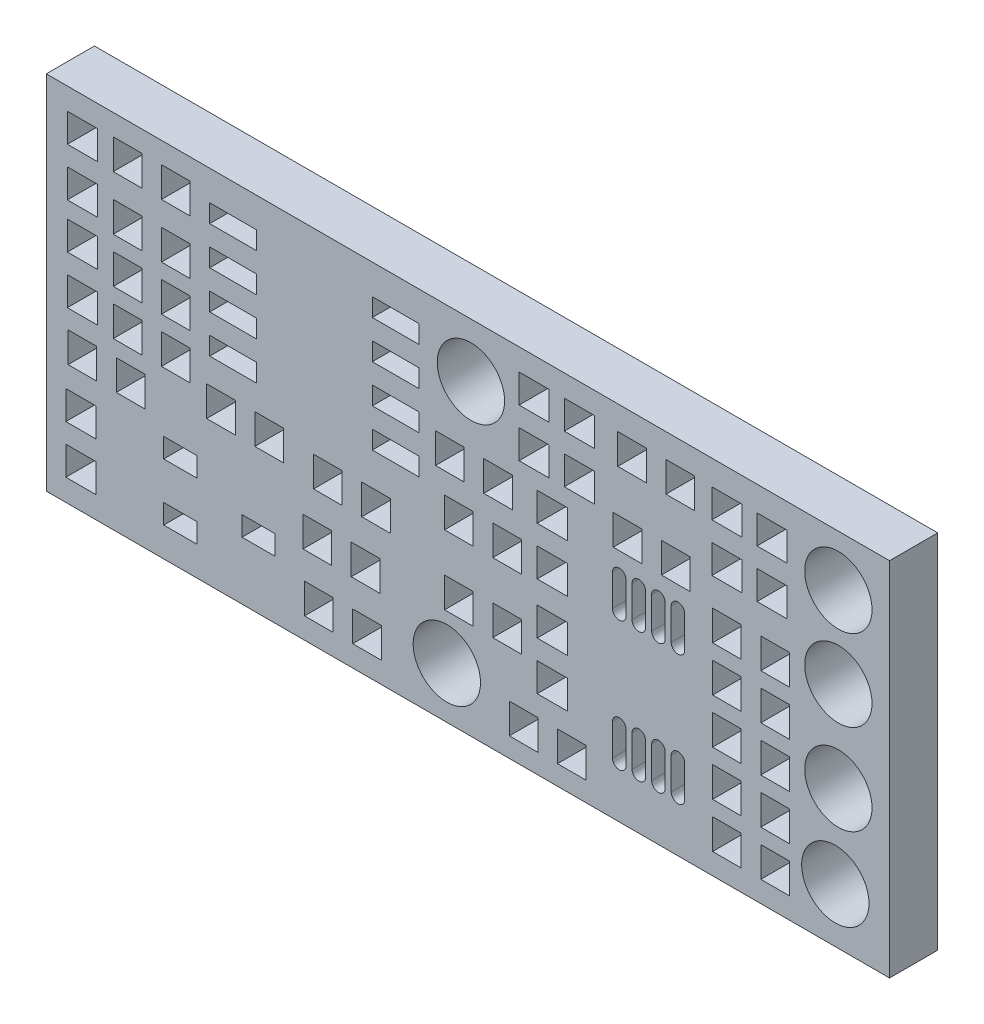
from build123d import *

# Parameters (mm, degrees)
MODEL_W            = 28
MODEL_H            = 12
MODEL_W_2          = 1
MODEL_H_2          = 0.95
MODEL_W_3          = 1.1
MODEL_H_3          = 0.65
MODEL_W_4          = 0.95
MODEL_H_4          = 1
MODEL_R            = 1.1176
MODEL_W_5          = 1.55
MODEL_H_5          = 0.6
BOSS_EXTRU_1_DEPTH = 1.6


with BuildPart() as part:
    # Model → Boss.-Extru.1 (new body)
    with BuildSketch(Plane.XY):
        with Locations((14, 6)):
            Rectangle(MODEL_W, MODEL_H)
        with Locations((1.15, 1.2)):
            Rectangle(MODEL_W_2, MODEL_H_2, mode=Mode.SUBTRACT)
        with Locations((4.45, 1.3)):
            Rectangle(MODEL_W_3, MODEL_H_3, mode=Mode.SUBTRACT)
        with Locations((1.15, 2.8)):
            Rectangle(MODEL_W_2, MODEL_H_2, mode=Mode.SUBTRACT)
        with Locations((9.05, 1.2)):
            Rectangle(MODEL_W_4, MODEL_H_4, mode=Mode.SUBTRACT)
        with Locations((10.65, 1.2)):
            Rectangle(MODEL_W_4, MODEL_H_4, mode=Mode.SUBTRACT)
        with Locations((7.05, 2.25)):
            Rectangle(MODEL_W_3, MODEL_H_3, mode=Mode.SUBTRACT)
        with Locations((13.3, 1.7)):
            Circle(MODEL_R, mode=Mode.SUBTRACT)
        with Locations((4.45, 3.2)):
            Rectangle(MODEL_W_3, MODEL_H_3, mode=Mode.SUBTRACT)
        with Locations((1.2, 4.5)):
            Rectangle(MODEL_W_4, MODEL_H_4, mode=Mode.SUBTRACT)
        with Locations((2.8, 4.5)):
            Rectangle(MODEL_W_4, MODEL_H_4, mode=Mode.SUBTRACT)
        with Locations((5.8, 5.25)):
            Rectangle(MODEL_W_4, MODEL_H_4, mode=Mode.SUBTRACT)
        with Locations((9, 3.1)):
            Rectangle(MODEL_W_4, MODEL_H_4, mode=Mode.SUBTRACT)
        with Locations((10.6, 3.1)):
            Rectangle(MODEL_W_4, MODEL_H_4, mode=Mode.SUBTRACT)
        with Locations((13.7, 3.7)):
            Rectangle(MODEL_W_4, MODEL_H_4, mode=Mode.SUBTRACT)
        with Locations((9.35, 5)):
            Rectangle(MODEL_W_4, MODEL_H_4, mode=Mode.SUBTRACT)
        with Locations((7.4, 5.25)):
            Rectangle(MODEL_W_4, MODEL_H_4, mode=Mode.SUBTRACT)
        with Locations((10.95, 5)):
            Rectangle(MODEL_W_4, MODEL_H_4, mode=Mode.SUBTRACT)
        with Locations((15.85, 1.15)):
            Rectangle(MODEL_W_4, MODEL_H_4, mode=Mode.SUBTRACT)
        with Locations((17.45, 1.15)):
            Rectangle(MODEL_W_4, MODEL_H_4, mode=Mode.SUBTRACT)
        with Locations((16.8, 2.8)):
            Rectangle(MODEL_W_2, MODEL_H_2, mode=Mode.SUBTRACT)
        with BuildLine():
            ThreePointArc((20.75, 2.775), (20.975, 3), (21.2, 2.775))
            Line((21.2, 2.775), (21.2, 1.725))
            ThreePointArc((21.2, 1.725), (20.975, 1.5), (20.75, 1.725))
            Line((20.75, 1.725), (20.75, 2.775))
        make_face(mode=Mode.SUBTRACT)
        with BuildLine():
            ThreePointArc((18.8, 2.775), (19.025, 3), (19.25, 2.775))
            Line((19.25, 2.775), (19.25, 1.725))
            ThreePointArc((19.25, 1.725), (19.025, 1.5), (18.8, 1.725))
            Line((18.8, 1.725), (18.8, 2.775))
        make_face(mode=Mode.SUBTRACT)
        with BuildLine():
            ThreePointArc((19.45, 2.775), (19.675, 3), (19.9, 2.775))
            Line((19.9, 2.775), (19.9, 1.725))
            ThreePointArc((19.9, 1.725), (19.675, 1.5), (19.45, 1.725))
            Line((19.45, 1.725), (19.45, 2.775))
        make_face(mode=Mode.SUBTRACT)
        with BuildLine():
            ThreePointArc((20.1, 2.775), (20.325, 3), (20.55, 2.775))
            Line((20.55, 2.775), (20.55, 1.725))
            ThreePointArc((20.55, 1.725), (20.325, 1.5), (20.1, 1.725))
            Line((20.1, 1.725), (20.1, 2.775))
        make_face(mode=Mode.SUBTRACT)
        with Locations((22.6, 1.2)):
            Rectangle(MODEL_W_4, MODEL_H_4, mode=Mode.SUBTRACT)
        with Locations((24.2, 1.2)):
            Rectangle(MODEL_W_4, MODEL_H_4, mode=Mode.SUBTRACT)
        with Locations((22.6, 2.7)):
            Rectangle(MODEL_W_4, MODEL_H_4, mode=Mode.SUBTRACT)
        with Locations((24.2, 2.7)):
            Rectangle(MODEL_W_4, MODEL_H_4, mode=Mode.SUBTRACT)
        with Locations((26.2, 1.8)):
            Circle(MODEL_R, mode=Mode.SUBTRACT)
        with Locations((15.3, 3.7)):
            Rectangle(MODEL_W_4, MODEL_H_4, mode=Mode.SUBTRACT)
        with Locations((16.8, 4.4)):
            Rectangle(MODEL_W_2, MODEL_H_2, mode=Mode.SUBTRACT)
        with Locations((22.6, 4.2)):
            Rectangle(MODEL_W_4, MODEL_H_4, mode=Mode.SUBTRACT)
        with Locations((24.2, 4.2)):
            Rectangle(MODEL_W_4, MODEL_H_4, mode=Mode.SUBTRACT)
        with Locations((22.6, 5.7)):
            Rectangle(MODEL_W_4, MODEL_H_4, mode=Mode.SUBTRACT)
        with Locations((24.2, 5.7)):
            Rectangle(MODEL_W_4, MODEL_H_4, mode=Mode.SUBTRACT)
        with Locations((26.3, 4.6)):
            Circle(MODEL_R, mode=Mode.SUBTRACT)
        with Locations((1.2, 6.1)):
            Rectangle(MODEL_W_2, MODEL_H_2, mode=Mode.SUBTRACT)
        with Locations((2.7, 6)):
            Rectangle(MODEL_W_4, MODEL_H_4, mode=Mode.SUBTRACT)
        with Locations((4.3, 6)):
            Rectangle(MODEL_W_4, MODEL_H_4, mode=Mode.SUBTRACT)
        with Locations((6.2, 6.895)):
            Rectangle(MODEL_W_5, MODEL_H_5, mode=Mode.SUBTRACT)
        with Locations((1.2, 7.7)):
            Rectangle(MODEL_W_2, MODEL_H_2, mode=Mode.SUBTRACT)
        with Locations((2.7, 7.5)):
            Rectangle(MODEL_W_4, MODEL_H_4, mode=Mode.SUBTRACT)
        with Locations((4.3, 7.5)):
            Rectangle(MODEL_W_4, MODEL_H_4, mode=Mode.SUBTRACT)
        with Locations((6.2, 8.165)):
            Rectangle(MODEL_W_5, MODEL_H_5, mode=Mode.SUBTRACT)
        with Locations((13.7, 6)):
            Rectangle(MODEL_W_4, MODEL_H_4, mode=Mode.SUBTRACT)
        with Locations((11.6, 6.895)):
            Rectangle(MODEL_W_5, MODEL_H_5, mode=Mode.SUBTRACT)
        with Locations((11.6, 8.165)):
            Rectangle(MODEL_W_5, MODEL_H_5, mode=Mode.SUBTRACT)
        with Locations((13.4, 7.7)):
            Rectangle(MODEL_W_4, MODEL_H_4, mode=Mode.SUBTRACT)
        with Locations((1.2, 9.2)):
            Rectangle(MODEL_W_2, MODEL_H_2, mode=Mode.SUBTRACT)
        with Locations((2.7, 9)):
            Rectangle(MODEL_W_4, MODEL_H_4, mode=Mode.SUBTRACT)
        with Locations((4.3, 9)):
            Rectangle(MODEL_W_4, MODEL_H_4, mode=Mode.SUBTRACT)
        with Locations((6.2, 9.435)):
            Rectangle(MODEL_W_5, MODEL_H_5, mode=Mode.SUBTRACT)
        with Locations((1.2, 10.8)):
            Rectangle(MODEL_W_2, MODEL_H_2, mode=Mode.SUBTRACT)
        with Locations((2.7, 10.8)):
            Rectangle(MODEL_W_4, MODEL_H_4, mode=Mode.SUBTRACT)
        with Locations((4.3, 10.8)):
            Rectangle(MODEL_W_4, MODEL_H_4, mode=Mode.SUBTRACT)
        with Locations((6.2, 10.705)):
            Rectangle(MODEL_W_5, MODEL_H_5, mode=Mode.SUBTRACT)
        with Locations((11.6, 9.435)):
            Rectangle(MODEL_W_5, MODEL_H_5, mode=Mode.SUBTRACT)
        with Locations((11.6, 10.705)):
            Rectangle(MODEL_W_5, MODEL_H_5, mode=Mode.SUBTRACT)
        with Locations((15.3, 6)):
            Rectangle(MODEL_W_4, MODEL_H_4, mode=Mode.SUBTRACT)
        with Locations((16.8, 6.1)):
            Rectangle(MODEL_W_2, MODEL_H_2, mode=Mode.SUBTRACT)
        with BuildLine():
            ThreePointArc((18.8, 7.075), (19.025, 7.3), (19.25, 7.075))
            Line((19.25, 7.075), (19.25, 6.025))
            ThreePointArc((19.25, 6.025), (19.025, 5.8), (18.8, 6.025))
            Line((18.8, 6.025), (18.8, 7.075))
        make_face(mode=Mode.SUBTRACT)
        with BuildLine():
            ThreePointArc((19.45, 7.075), (19.675, 7.3), (19.9, 7.075))
            Line((19.9, 7.075), (19.9, 6.025))
            ThreePointArc((19.9, 6.025), (19.675, 5.8), (19.45, 6.025))
            Line((19.45, 6.025), (19.45, 7.075))
        make_face(mode=Mode.SUBTRACT)
        with BuildLine():
            ThreePointArc((20.1, 7.075), (20.325, 7.3), (20.55, 7.075))
            Line((20.55, 7.075), (20.55, 6.025))
            ThreePointArc((20.55, 6.025), (20.325, 5.8), (20.1, 6.025))
            Line((20.1, 6.025), (20.1, 7.075))
        make_face(mode=Mode.SUBTRACT)
        with BuildLine():
            ThreePointArc((20.75, 7.075), (20.975, 7.3), (21.2, 7.075))
            Line((21.2, 7.075), (21.2, 6.025))
            ThreePointArc((21.2, 6.025), (20.975, 5.8), (20.75, 6.025))
            Line((20.75, 6.025), (20.75, 7.075))
        make_face(mode=Mode.SUBTRACT)
        with Locations((15, 7.7)):
            Rectangle(MODEL_W_4, MODEL_H_4, mode=Mode.SUBTRACT)
        with Locations((16.8, 7.7)):
            Rectangle(MODEL_W_2, MODEL_H_2, mode=Mode.SUBTRACT)
        with Locations((19.3, 8.3)):
            Rectangle(MODEL_W_4, MODEL_H_4, mode=Mode.SUBTRACT)
        with Locations((20.9, 8.3)):
            Rectangle(MODEL_W_4, MODEL_H_4, mode=Mode.SUBTRACT)
        with Locations((22.6, 7.2)):
            Rectangle(MODEL_W_4, MODEL_H_4, mode=Mode.SUBTRACT)
        with Locations((24.2, 7.2)):
            Rectangle(MODEL_W_4, MODEL_H_4, mode=Mode.SUBTRACT)
        with Locations((26.3, 7.6)):
            Circle(MODEL_R, mode=Mode.SUBTRACT)
        with Locations((16.2, 9.2)):
            Rectangle(MODEL_W_2, MODEL_H_2, mode=Mode.SUBTRACT)
        with Locations((14.1, 10.2)):
            Circle(MODEL_R, mode=Mode.SUBTRACT)
        with Locations((17.7, 9.2)):
            Rectangle(MODEL_W_2, MODEL_H_2, mode=Mode.SUBTRACT)
        with Locations((16.2, 10.8)):
            Rectangle(MODEL_W_2, MODEL_H_2, mode=Mode.SUBTRACT)
        with Locations((17.7, 10.8)):
            Rectangle(MODEL_W_2, MODEL_H_2, mode=Mode.SUBTRACT)
        with Locations((19.45, 10.7)):
            Rectangle(MODEL_W_4, MODEL_H_4, mode=Mode.SUBTRACT)
        with Locations((22.6, 9.1)):
            Rectangle(MODEL_W_2, MODEL_H_2, mode=Mode.SUBTRACT)
        with Locations((24.1, 9.1)):
            Rectangle(MODEL_W_2, MODEL_H_2, mode=Mode.SUBTRACT)
        with Locations((26.3, 10.3)):
            Circle(MODEL_R, mode=Mode.SUBTRACT)
        with Locations((21.05, 10.7)):
            Rectangle(MODEL_W_4, MODEL_H_4, mode=Mode.SUBTRACT)
        with Locations((22.6, 10.7)):
            Rectangle(MODEL_W_2, MODEL_H_2, mode=Mode.SUBTRACT)
        with Locations((24.1, 10.7)):
            Rectangle(MODEL_W_2, MODEL_H_2, mode=Mode.SUBTRACT)
    extrude(amount=BOSS_EXTRU_1_DEPTH)


solid = part.part
